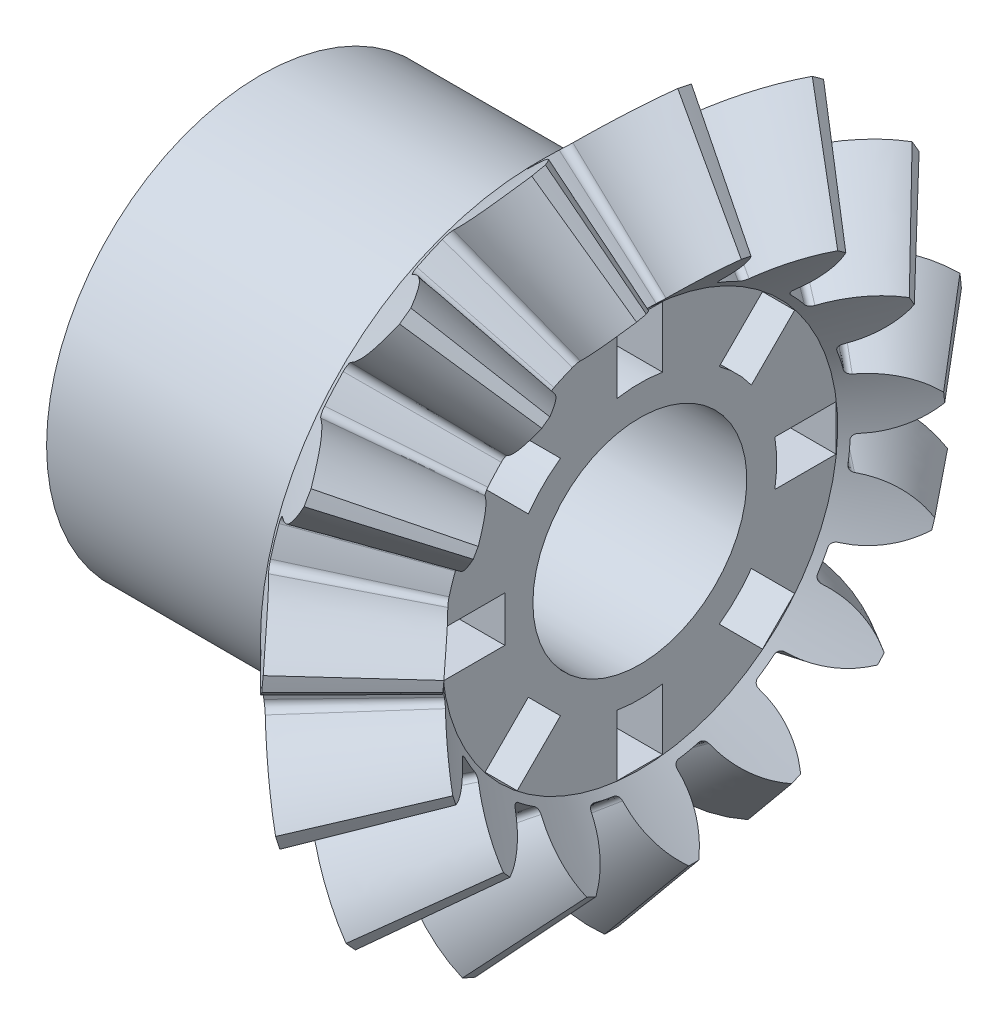
from build123d import *

# Parameters (mm, degrees)
TEETHCUTS_COUNT    = 15
TEETHCUTS_ANGLE    = 336
HUBSKE_R           = 5
HUB_DEPTH          = 6.449164146
BORSKE_R           = 2.5
BORE_DEPTH         = 15.0000508
SKETCH1_W          = 1.429659396
SKETCH1_H          = 1.062231574
CUT_EXTRUDE1_DEPTH = 3


with BuildPart() as part:
    # BasProSke → Base-Revolve (revolve)
    with BuildSketch(Plane(origin=(0, 0, 0), x_dir=(1, 0, 0), z_dir=(0, 1, 0)), mode=Mode.PRIVATE) as base_revolve_sk:
        Polygon((0, 0), (0, 6.449062547), (1.758044236, 8.207106781), (3.679364578, 5.885786435), (2.418570342, 4.624992202), (2.418570342, 0), align=None)
    revolve(base_revolve_sk.sketch.rotate(Axis((-10, 0, 0), (1, 0, 0)), 180), axis=Axis((-10, 0, 0), (1, 0, 0)))

    # ToothCut: read off the stored shape, not the designer's step
    # ToothCut: loft between two sections, ruled curve by curve
    toothcut_from = [
        Edge.make_bspline([(8.556636876, 0.005699421, -0.00981443), (8.552535972, 0.001598517, -0.014577377), (8.547257659, -0.003679795, -0.013803217), (8.543935172, -0.007002282, -0.007951495)], [0, 0, 0, 0, 1, 1, 1, 1], 3, [1, 0.802131569, 0.802131569, 1]),
        Edge.make_bspline([(8.543935172, -0.007002282, 0.007951495), (8.547257659, -0.003679795, 0.013803217), (8.552535972, 0.001598517, 0.014577377), (8.556636876, 0.005699421, 0.00981443)], [0, 0, 0, 0, 1, 1, 1, 1], 3, [1, 0.802131569, 0.802131569, 1]),
        Edge.make_bspline([(8.543935172, -0.007002282, -0.007951495), (8.543374632, -0.007562822, -0.006964246), (8.542923925, -0.008013529, -0.005870263), (8.542593037, -0.008344417, -0.004693786)], [0, 0, 0, 0, 1, 1, 1, 1], 3, [1, 0.992614494, 0.992614494, 1]),
        Edge.make_bspline([(8.542593037, -0.008344417, 0.004693786), (8.542923925, -0.008013529, 0.005870263), (8.543374632, -0.007562822, 0.006964246), (8.543935172, -0.007002282, 0.007951495)], [0, 0, 0, 0, 1, 1, 1, 1], 3, [1, 0.992614494, 0.992614494, 1]),
        Edge.make_bspline([(8.542593037, -0.008344417, -0.004693786), (8.541734743, -0.009202712, -0.001642108), (8.541734743, -0.009202712, 0.001642108), (8.542593037, -0.008344417, 0.004693786)], [0, 0, 0, 0, 1, 1, 1, 1], 3, [1, 0.952796767, 0.952796767, 1]),
        Edge.make_line((8.556636876, 0.005699421, 0.00981443), (8.556636876, 0.005699421, -0.00981443)),
    ]
    toothcut_to = [
        Edge.make_bspline([(1.761212226, 8.21027477, -1.686035672), (1.408065293, 7.857127838, -1.029094215), (0.901482254, 7.3505448, -0.619527564), (0.322010524, 6.771073071, -0.522457393)], [0, 0, 0, 0, 1, 1, 1, 1], 3, [1, 0.946999532, 0.946999532, 1]),
        Edge.make_bspline([(0.322010524, 6.771073071, 0.522457393), (0.901482254, 7.3505448, 0.619527564), (1.408065293, 7.857127838, 1.029094215), (1.761212226, 8.21027477, 1.686035672)], [0, 0, 0, 0, 1, 1, 1, 1], 3, [1, 0.946999532, 0.946999532, 1]),
        Edge.make_bspline([(0.322010524, 6.771073071, -0.522457393), (0.248299095, 6.697361642, -0.510109627), (0.200442072, 6.649504619, -0.42986857), (0.204264971, 6.653327518, -0.325035429)], [0, 0, 0, 0, 1, 1, 1, 1], 3, [1, 0.820120319, 0.820120319, 1]),
        Edge.make_bspline([(0.204264971, 6.653327518, 0.325035429), (0.200442072, 6.649504619, 0.42986857), (0.248299095, 6.697361642, 0.510109627), (0.322010524, 6.771073071, 0.522457393)], [0, 0, 0, 0, 1, 1, 1, 1], 3, [1, 0.820120319, 0.820120319, 1]),
        Edge.make_bspline([(0.204264971, 6.653327518, -0.325035429), (0.212163412, 6.661225959, -0.108441089), (0.212163412, 6.661225959, 0.108441089), (0.204264971, 6.653327518, 0.325035429)], [0, 0, 0, 0, 1, 1, 1, 1], 3, [1, 0.999115227, 0.999115227, 1]),
        Edge.make_line((1.761212226, 8.21027477, 1.686035672), (1.761212226, 8.21027477, -1.686035672)),
    ]
    toothcut = Solid(Shell([*[Face.make_surface_from_curves(toothcut_from[k], toothcut_to[k]) for k in range(6)], Face(Wire(toothcut_from)), Face(Wire(toothcut_to))]))
    add(toothcut, mode=Mode.SUBTRACT)

    # TeethCuts: ToothCut ×15 about axis
    teethcuts_axis = Axis((-10, 0, 0), (1, 0, 0))
    for i in range(1, TEETHCUTS_COUNT):
        add(toothcut.rotate(teethcuts_axis, i * TEETHCUTS_ANGLE / (TEETHCUTS_COUNT - 1)), mode=Mode.SUBTRACT)

    # HubSke → Hub (add)
    with BuildSketch(Plane.ZY):
        with Locations(Location((0, 0, 0), (0, 0, 180))):
            Circle(HUBSKE_R)
    extrude(amount=HUB_DEPTH)

    # BorSke → Bore (cut, symmetric)
    with BuildSketch(Plane(origin=(0, 0, 0), x_dir=(0, 0, -1), z_dir=(1, 0, 0))):
        with Locations(Location((0, 0, 0), (0, 0, 180))):
            Circle(BORSKE_R)
    extrude(amount=BORE_DEPTH, both=True, mode=Mode.SUBTRACT)

    # Sketch1 → Cut-Extrude1 (cut)
    with BuildSketch(Plane(origin=(2.418570342, 0, 0), x_dir=(0, 0, -1), z_dir=(1, 0, 0))):
        Polygon((-3.617835313, -2.866724163), (-2.60691346, -1.85580231), (-1.85580231, -2.60691346), (-2.866724163, -3.617835313), align=None)
        with BuildLine():
            Line((-0.531115787, -4.585275979), (0.531115787, -4.585275979))
            Line((0.531115787, -4.585275979), (0.531115787, -3.155616583))
            ThreePointArc((0.531115787, -3.155616583), (0, -3.2), (-0.531115787, -3.155616583))
            Line((-0.531115787, -3.155616583), (-0.531115787, -4.585275979))
        make_face()
        with Locations((-3.870446281, 0)):
            Rectangle(SKETCH1_W, SKETCH1_H)
        with BuildLine():
            Line((-2.866724163, 3.617835313), (-1.85580231, 2.60691346))
            ThreePointArc((-1.85580231, 2.60691346), (-2.2627417, 2.2627417), (-2.60691346, 1.85580231))
            Line((-2.60691346, 1.85580231), (-3.617835313, 2.866724163))
            Line((-3.617835313, 2.866724163), (-2.866724163, 3.617835313))
        make_face()
        with BuildLine():
            Line((0.531115787, 4.585275979), (0.531115787, 3.155616583))
            ThreePointArc((0.531115787, 3.155616583), (0, 3.2), (-0.531115787, 3.155616583))
            Line((-0.531115787, 3.155616583), (-0.531115787, 4.585275979))
            Line((-0.531115787, 4.585275979), (0.531115787, 4.585275979))
        make_face()
        with BuildLine():
            Line((3.617835313, 2.866724163), (2.60691346, 1.85580231))
            ThreePointArc((2.60691346, 1.85580231), (2.2627417, 2.2627417), (1.85580231, 2.60691346))
            Line((1.85580231, 2.60691346), (2.866724163, 3.617835313))
            Line((2.866724163, 3.617835313), (3.617835313, 2.866724163))
        make_face()
        with BuildLine():
            Line((4.585275979, -0.531115787), (3.155616583, -0.531115787))
            ThreePointArc((3.155616583, -0.531115787), (3.2, 0), (3.155616583, 0.531115787))
            Line((3.155616583, 0.531115787), (4.585275979, 0.531115787))
            Line((4.585275979, 0.531115787), (4.585275979, -0.531115787))
        make_face()
        with BuildLine():
            Line((2.866724163, -3.617835313), (1.85580231, -2.60691346))
            ThreePointArc((1.85580231, -2.60691346), (2.2627417, -2.2627417), (2.60691346, -1.85580231))
            Line((2.60691346, -1.85580231), (3.617835313, -2.866724163))
            Line((3.617835313, -2.866724163), (2.866724163, -3.617835313))
        make_face()
    extrude(amount=-CUT_EXTRUDE1_DEPTH, mode=Mode.SUBTRACT)


solid = part.part
